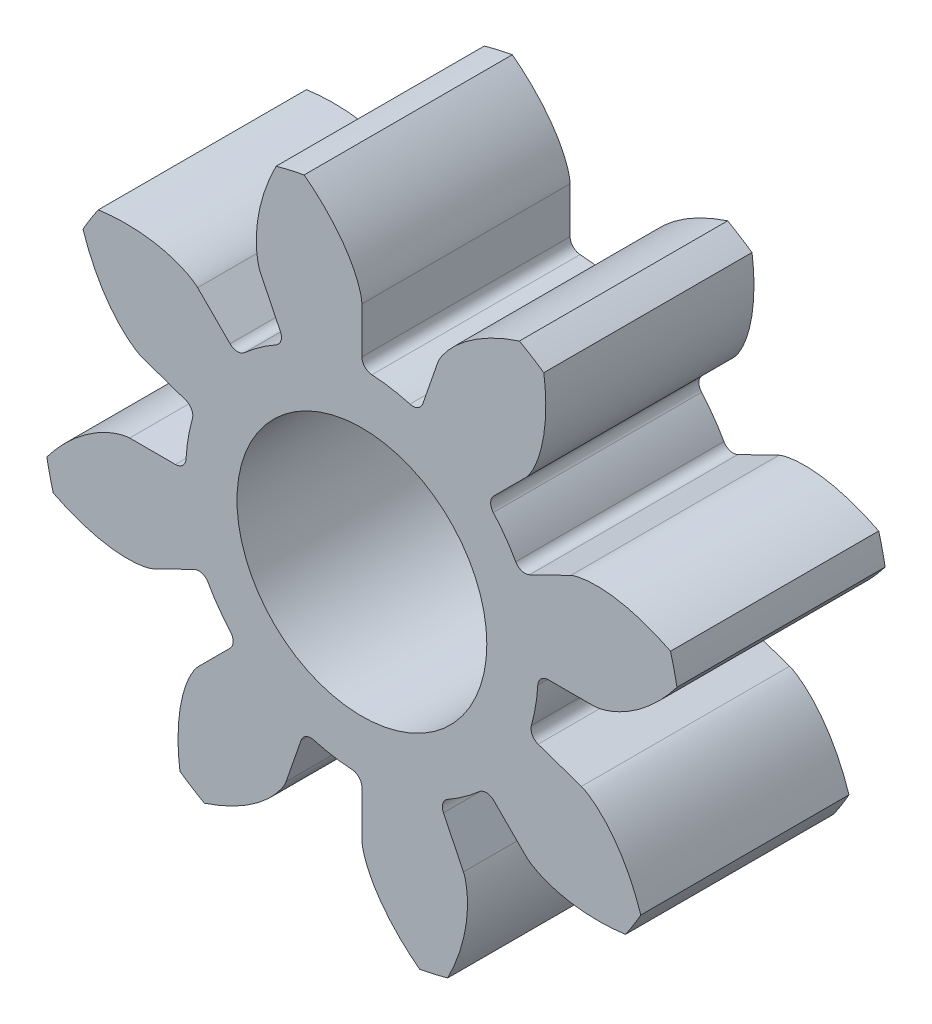
from build123d import *

# Parameters (mm, degrees)
SKETCH2_R                = 7.692307692
BOSS_EXTRUDE1_DEPTH      = 5
CUT_EXTRUDE1_DEPTH       = 5
FILLET1_R                = 0.254
CIRPATTERN3_COUNT        = 8
FILLET1_OF_CIRPATTERN3_R = 0.254
SKETCH6_R                = 3
CUT_EXTRUDE4_DEPTH       = 12.810610426


# Read off the part's stored shape, not the designer's step: Cut-Extrude1
with BuildPart() as part:
    # Sketch2 → Boss-Extrude1 (new body)
    with BuildSketch(Plane.XY):
        Circle(SKETCH2_R)
    extrude(amount=BOSS_EXTRUDE1_DEPTH)

    # Cut-Extrude1 outline → Cut-Extrude1 (cut)
    with BuildSketch(Plane.XY):
        with BuildLine():
            add(Edge.make_bspline(
                [(6.697692398, -3.783188362), (6.694942595, -3.774755141), (6.679375272, -3.727486336), (6.651054353, -3.6462273), (6.601636527, -3.5095894), (6.540169991, -3.36172331), (6.470026282, -3.203971922), (6.396266917, -3.056285154), (6.315559315, -2.90704734), (6.229664162, -2.763962931), (6.137187552, -2.62298336), (6.040460676, -2.48997966), (5.950345318, -2.377455821), (5.869387065, -2.285202623), (5.799397916, -2.211075897), (5.739889017, -2.151906125), (5.678435318, -2.094656098), (5.61498696, -2.039686998), (5.549489975, -1.987259012), (5.487407839, -1.941903086), (5.429285985, -1.903298438), (5.378587706, -1.872958167), (5.33845301, -1.851238723), (5.306218209, -1.83577634), (5.286094355, -1.8271527), (5.275252774, -1.823120029), (5.271354772, -1.821772885)],
                knots=[0.097752153, 0.097752153, 0.097752153, 0.097752153, 0.097752153, 0.109464833, 0.164197228, 0.218929529, 0.273661934, 0.328394301, 0.383126635, 0.43785898, 0.492591256, 0.547323565, 0.602055884, 0.652783571, 0.680149903, 0.707515961, 0.734882063, 0.762248421, 0.789614741, 0.816980391, 0.844236067, 0.862480777, 0.880559096, 0.894007228, 0.903714168, 0.909090916, 0.909090916, 0.909090916, 0.909090916, 0.909090916], degree=4))
            ThreePointArc((6.697692398, -3.783188362), (7.58609007, -1.273905441), (7.566059562, 1.387926631))
            add(Edge.make_bspline(
                [(5.577278689, 0), (5.581402913, 0), (5.592967052, 0.000270157), (5.614803918, 0.001847481), (5.650321243, 0.005932488), (5.695348959, 0.013350907), (5.753176748, 0.025466777), (5.820720408, 0.042968857), (5.894212371, 0.065558301), (5.973241904, 0.093716456), (6.051165214, 0.124945509), (6.127948323, 0.158981915), (6.203520376, 0.195468017), (6.293883387, 0.242667369), (6.400534692, 0.303415953), (6.522462058, 0.380332203), (6.65732787, 0.474445357), (6.790781803, 0.577485206), (6.918702812, 0.684664219), (7.043730777, 0.799353582), (7.161684992, 0.914846563), (7.279509403, 1.041033124), (7.385903648, 1.160710943), (7.477242478, 1.273712073), (7.530552549, 1.341263104), (7.560705948, 1.380854189), (7.566059562, 1.387926631)],
                knots=[0, 0, 0, 0, 0, 0.005376748, 0.015083688, 0.02853182, 0.046610139, 0.064854849, 0.092110525, 0.119476175, 0.146842495, 0.174208853, 0.201574955, 0.228941013, 0.256307345, 0.307035032, 0.361767351, 0.41649966, 0.471231936, 0.525964281, 0.580696615, 0.635428982, 0.690161387, 0.744893688, 0.799626083, 0.811338763, 0.811338763, 0.811338763, 0.811338763, 0.811338763], degree=4))
            Line((5.577278689, 0), (4.230769231, 0))
            ThreePointArc((4.230769231, 0), (4.172349539, -0.700647993), (3.998703815, -1.381946483))
            Line((3.998703815, -1.381946483), (5.271354772, -1.821772885))
        make_face()
    cut_extrude1 = extrude(amount=CUT_EXTRUDE1_DEPTH, mode=Mode.SUBTRACT)

    # Fillet1
    fillet1_edges = [part.edges().sort_by_distance(p)[0] for p in [
        (3.998703815, -1.381946483, 2.5),
        (4.230769231, 0, 2.5),
    ]]
    fillet(fillet1_edges, radius=FILLET1_R)

    # CirPattern3: Cut-Extrude1 ×8 about axis
    cirpattern3_axis = Axis((0, 0, 55), (0, 0, -1))
    for i in range(1, CIRPATTERN3_COUNT):
        add(cut_extrude1.rotate(cirpattern3_axis, i * 360 / CIRPATTERN3_COUNT), mode=Mode.SUBTRACT)

    # Fillet1 of CirPattern3
    fillet1_of_cirpattern3_edges = [part.edges().sort_by_distance(p)[0] for p in [
        (1.850326854, -3.804694313, 2.5),
        (2.991605613, -2.991605613, 2.5),
        (-1.381946483, -3.998703815, 2.5),
        (0, -4.230769231, 2.5),
        (-3.804694313, -1.850326854, 2.5),
        (-2.991605613, -2.991605613, 2.5),
        (-3.998703815, 1.381946483, 2.5),
        (-4.230769231, 0, 2.5),
        (-1.850326854, 3.804694313, 2.5),
        (-2.991605613, 2.991605613, 2.5),
        (1.381946483, 3.998703815, 2.5),
        (0, 4.230769231, 2.5),
        (3.804694313, 1.850326854, 2.5),
        (2.991605613, 2.991605613, 2.5),
    ]]
    fillet(fillet1_of_cirpattern3_edges, radius=FILLET1_OF_CIRPATTERN3_R)

    # Sketch6 → Cut-Extrude4 (cut, through all)
    with BuildSketch(Plane.XY.offset(5)):
        Circle(SKETCH6_R)
    extrude(amount=-CUT_EXTRUDE4_DEPTH, mode=Mode.SUBTRACT)


solid = part.part
